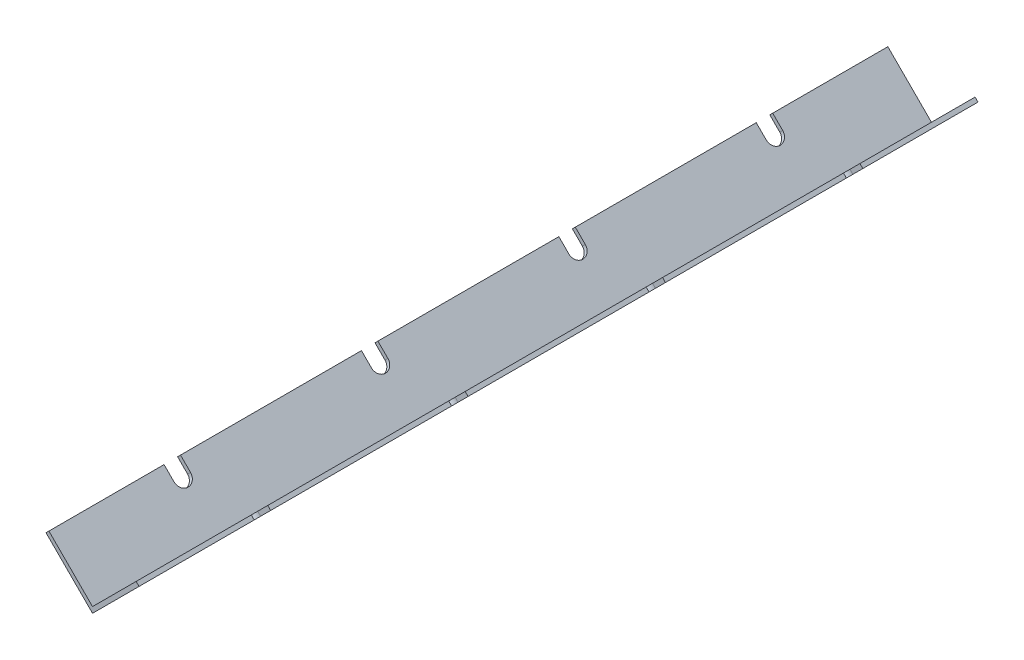
from build123d import *

# Parameters (mm, degrees)
BOSS_EXTRUDE1_DEPTH     = 323.85
CUT_EXTRUDE2_DEPTH      = 325.908548792
CUT_EXTRUDE2_DEPTH_BACK = 325.908548792
CUT_EXTRUDE3_DEPTH      = 325.908548792


with BuildPart() as part:
    # Sketch1 → Boss-Extrude1 (new body)
    with BuildSketch(Plane.XY):
        Polygon((0, 0), (-17.960512242, 17.960512242), (-16.837980227, 19.083044257), (0, 2.24506403), (16.837980227, 19.083044257), (17.960512242, 17.960512242), align=None)
    extrude(amount=BOSS_EXTRUDE1_DEPTH)

    # Sketch3 → Cut-Extrude2 (cut, two sides: drawn at the far end of the back side and taken through both)
    with BuildSketch(Plane(origin=(0, 0, 0), x_dir=(0, 0, -1), z_dir=(1, 0, 0)).offset(-CUT_EXTRUDE2_DEPTH_BACK)):
        with BuildLine():
            Line((-196.85, 19.083044257), (-203.2, 19.083044257))
            Line((-203.2, 19.083044257), (-203.2, 16.162044257))
            ThreePointArc((-203.2, 16.162044257), (-200.025, 12.987044257), (-196.85, 16.162044257))
            Line((-196.85, 16.162044257), (-196.85, 19.083044257))
        make_face()
        with BuildLine():
            Line((-120.65, 19.083044257), (-127, 19.083044257))
            Line((-127, 19.083044257), (-127, 16.162044257))
            ThreePointArc((-127, 16.162044257), (-123.825, 12.987044257), (-120.65, 16.162044257))
            Line((-120.65, 16.162044257), (-120.65, 19.083044257))
        make_face()
        with BuildLine():
            Line((-44.45, 19.083044257), (-50.8, 19.083044257))
            Line((-50.8, 19.083044257), (-50.8, 16.162044257))
            ThreePointArc((-50.8, 16.162044257), (-47.625, 12.987044257), (-44.45, 16.162044257))
            Line((-44.45, 16.162044257), (-44.45, 19.083044257))
        make_face()
        with BuildLine():
            Line((-279.4, 19.083044257), (-279.4, 16.162044257))
            ThreePointArc((-279.4, 16.162044257), (-276.225, 12.987044257), (-273.05, 16.162044257))
            Line((-273.05, 16.162044257), (-273.05, 19.083044257))
            Line((-273.05, 19.083044257), (-279.4, 19.083044257))
        make_face()
    extrude(amount=CUT_EXTRUDE2_DEPTH + CUT_EXTRUDE2_DEPTH_BACK, mode=Mode.SUBTRACT)

    # Sketch4 → Cut-Extrude3 (cut, symmetric)
    with BuildSketch(Plane(origin=(0, 0, 0), x_dir=(0, 0, -1), z_dir=(0.7071067811865506, -0.7071067811865446, 0))):
        with BuildLine():
            Line((-279.4, 25.4), (-279.4, 19.953954124))
            ThreePointArc((-279.4, 19.953954124), (-276.225, 16.778954124), (-273.05, 19.953954124))
            Line((-273.05, 19.953954124), (-273.05, 25.4))
            Line((-273.05, 25.4), (-279.4, 25.4))
        make_face()
        with BuildLine():
            Line((-203.2, 25.4), (-203.2, 19.953954124))
            ThreePointArc((-203.2, 19.953954124), (-200.025, 16.778954124), (-196.85, 19.953954124))
            Line((-196.85, 19.953954124), (-196.85, 25.4))
            Line((-196.85, 25.4), (-203.2, 25.4))
        make_face()
        with BuildLine():
            Line((-127, 25.4), (-127, 19.953954124))
            ThreePointArc((-127, 19.953954124), (-123.825, 16.778954124), (-120.65, 19.953954124))
            Line((-120.65, 19.953954124), (-120.65, 25.4))
            Line((-120.65, 25.4), (-127, 25.4))
        make_face()
        with BuildLine():
            Line((-50.8, 25.4), (-50.8, 19.953954124))
            ThreePointArc((-50.8, 19.953954124), (-47.625, 16.778954124), (-44.45, 19.953954124))
            Line((-44.45, 19.953954124), (-44.45, 25.4))
            Line((-44.45, 25.4), (-50.8, 25.4))
        make_face()
    cut_extrude3 = extrude(amount=CUT_EXTRUDE3_DEPTH, both=True, mode=Mode.SUBTRACT)

    # Mirror1: Cut-Extrude3 across plane
    add(cut_extrude3.mirror(Plane(origin=(0, 0, 0), x_dir=(0, 0, 1), z_dir=(1, 0, 0))), mode=Mode.SUBTRACT)


solid = part.part
